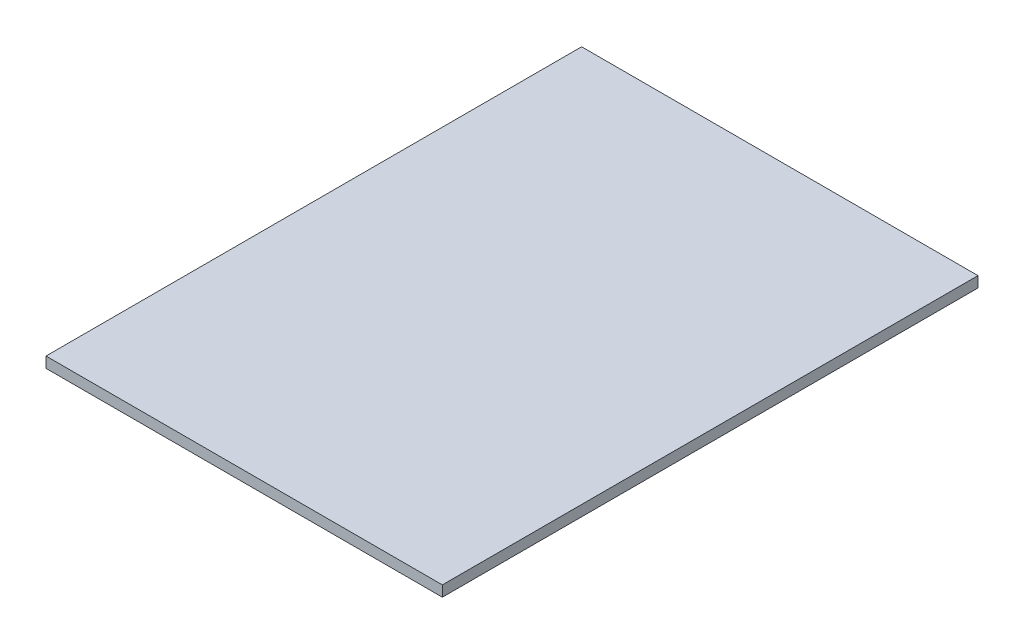
from build123d import *

# Parameters (mm, degrees)
SKETCH_2_W      = 74
SKETCH_2_H      = 100
EXTRUDE_1_DEPTH = 2


with BuildPart() as part:
    # 草图2 → 凸台-拉伸1 (new body)
    with BuildSketch(Plane(origin=(0, 0, 0), x_dir=(1, 0, 0), z_dir=(0, 1, 0))):
        Rectangle(SKETCH_2_W, SKETCH_2_H)
    extrude(amount=EXTRUDE_1_DEPTH)


solid = part.part
